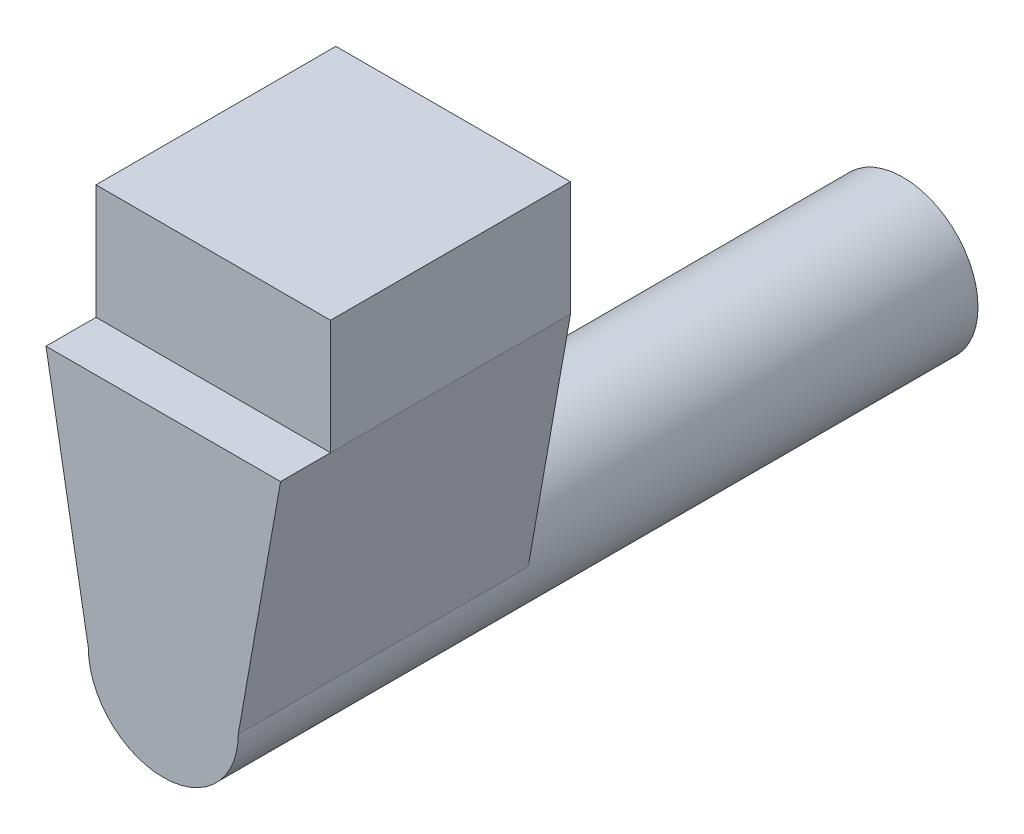
from build123d import *
from build123d.topology import SkipClean

# Parameters (mm, degrees)
SKETCH1_W               = 48
SKETCH1_H               = 53
BOSS_EXTRUDE1_DEPTH     = 10
SKETCH2_W               = 48
SKETCH2_H               = 5.616325
BOSS_EXTRUDE2_DEPTH     = 33.1917878
SKETCH4_W               = 4
SKETCH4_H               = 10
BOSS_EXTRUDE4_DEPTH     = 40
SKETCH5_W               = 48
SKETCH5_H               = 10.8609375
BOSS_EXTRUDE5_DEPTH     = 23.1917878
SKETCH6_W               = 48
SKETCH6_H               = 5
BOSS_EXTRUDE6_DEPTH     = 42.3
SKETCH7_W               = 12.8082122
SKETCH7_H               = 16.4772625
BOSS_EXTRUDE7_DEPTH     = 48
CUT_EXTRUDE1_REACH      = 84.426
SKETCH8_R               = 11.5
SKETCH8_R_2             = 2
FILLET1_R               = 10
FILLET2_R               = 4
SKETCH9_W               = 5
SKETCH9_H               = 16.4772625
BOSS_EXTRUDE9_DEPTH     = 48
CUT_EXTRUDE2_DEPTH      = 88.252507127
SKETCH11_W              = 51
SKETCH11_H              = 16.4772625
BOSS_EXTRUDE10_DEPTH    = 49.45
BOSS_EXTRUDE11_DEPTH    = 46
SKETCH16_W              = 47.95
SKETCH16_H              = 51
BOSS_EXTRUDE14_DEPTH    = 2.55
SKETCH14_W              = 5
SKETCH14_H              = 42.3
BOSS_EXTRUDE13_DEPTH    = 1.5
SKETCH17_W              = 51
SKETCH17_H              = 19.0272625
BOSS_EXTRUDE15_DEPTH    = 9
BOSS_EXTRUDE16_DEPTH    = 25
SKETCH19_R              = 1.9304
CUT_EXTRUDE3_DEPTH      = 125.404890183
MIRROR2_START           = 33.1917878
MIRROR2_DEPTH           = 51
MIRROR2_START_2         = 76.1917878
MIRROR2_2_OUTLINE_W     = 47.95
MIRROR2_2_OUTLINE_H     = 25
MIRROR2_2_OUTLINE_R     = 1.9304
MIRROR2_2_DEPTH         = 8
MIRROR2_3_OUTLINE_W     = 45
MIRROR2_3_OUTLINE_H     = 42.3
MIRROR2_3_OUTLINE_R     = 2
MIRROR2_3_OUTLINE_R_2   = 11.5
MIRROR2_3_DEPTH         = 5
SKETCH20_W              = 103.287975037
SKETCH20_H              = 97.84889924
CUT_EXTRUDE4_DEPTH      = 144.929961559
SKETCH21_W              = 49.5
SKETCH21_H              = 42.3
CUT_EXTRUDE5_DEPTH      = 128.391431036
SKETCH24_R              = 7.5
BOSS_EXTRUDE18_DEPTH    = 45
BOSS_EXTRUDE19_DEPTH    = 29
SKETCH26_R              = 3.937
CUT_EXTRUDE6_DEPTH      = 135.023808387
CUT_EXTRUDE7_DEPTH      = 133.174975247
CUT_EXTRUDE7_DEPTH_BACK = 133.174975247
SKETCH27_W              = 131.04651434
SKETCH27_H              = 69.942394415
SKETCH30_W              = 22
SKETCH30_H              = 11.4772625
SKETCH30_W_2            = 5
CUT_EXTRUDE10_DEPTH     = 95.954850856


# Read off the part's stored shape, not the designer's step: Mirror2
with BuildPart() as part:
    # Sketch1 → Boss-Extrude1 (new body)
    with BuildSketch(Plane.XY):
        with Locations((24, 26.5)):
            Rectangle(SKETCH1_W, SKETCH1_H)
    extrude(amount=BOSS_EXTRUDE1_DEPTH)

    # Sketch2 → Boss-Extrude2 (add)
    with BuildSketch(Plane(origin=(0, 0, 0), x_dir=(-1, 0, 0), z_dir=(0, 0, -1))):
        with Locations((-24, -2.8081625)):
            Rectangle(SKETCH2_W, SKETCH2_H)
    extrude(amount=-BOSS_EXTRUDE2_DEPTH)

    # Sketch4 → Boss-Extrude4 (add)
    with BuildSketch(Plane.XY.offset(10)):
        with Locations((2, 48)):
            Rectangle(SKETCH4_W, SKETCH4_H)
        with Locations((46, 48)):
            Rectangle(SKETCH4_W, SKETCH4_H)
    extrude(amount=BOSS_EXTRUDE4_DEPTH)

    # Sketch5 → Boss-Extrude5 (add)
    with BuildSketch(Plane.XY.offset(10)):
        with Locations((24, 5.43046875)):
            Rectangle(SKETCH5_W, SKETCH5_H)
    extrude(amount=BOSS_EXTRUDE5_DEPTH)

    # Sketch6 → Boss-Extrude6 (add)
    with BuildSketch(Plane.XZ.offset(5.616325)):
        with Locations((24, 30.6917878)):
            Rectangle(SKETCH6_W, SKETCH6_H)
    extrude(amount=BOSS_EXTRUDE6_DEPTH)

    # Sketch7 → Boss-Extrude7 (add)
    with BuildSketch(Plane.ZY):
        with Locations((-6.4041061, 2.62230625)):
            Rectangle(SKETCH7_W, SKETCH7_H)
    extrude(amount=-BOSS_EXTRUDE7_DEPTH)

    # Sketch8 → Cut-Extrude1 (cut, up to next)
    with BuildSketch(Plane(origin=(0, 0, 28.1917878), x_dir=(-1, 0, 0), z_dir=(0, 0, -1)), mode=Mode.PRIVATE) as cut_extrude1_sk1:
        with Locations((-24, -26.616325)):
            Circle(SKETCH8_R)
    cut_extrude1_tool1 = extrude(cut_extrude1_sk1.sketch, amount=-CUT_EXTRUDE1_REACH, mode=Mode.PRIVATE) & part.part
    # Sketch8 → Cut-Extrude1 (cut, up to next)
    with BuildSketch(Plane(origin=(0, 0, 28.1917878), x_dir=(-1, 0, 0), z_dir=(0, 0, -1)), mode=Mode.PRIVATE) as cut_extrude1_sk2:
        with Locations((-39.5, -11.116325)):
            Circle(SKETCH8_R_2)
    cut_extrude1_tool2 = extrude(cut_extrude1_sk2.sketch, amount=-CUT_EXTRUDE1_REACH, mode=Mode.PRIVATE) & part.part
    # Sketch8 → Cut-Extrude1 (cut, up to next)
    with BuildSketch(Plane(origin=(0, 0, 28.1917878), x_dir=(-1, 0, 0), z_dir=(0, 0, -1)), mode=Mode.PRIVATE) as cut_extrude1_sk3:
        with Locations((-39.5, -42.116325)):
            Circle(SKETCH8_R_2)
    cut_extrude1_tool3 = extrude(cut_extrude1_sk3.sketch, amount=-CUT_EXTRUDE1_REACH, mode=Mode.PRIVATE) & part.part
    # Sketch8 → Cut-Extrude1 (cut, up to next)
    with BuildSketch(Plane(origin=(0, 0, 28.1917878), x_dir=(-1, 0, 0), z_dir=(0, 0, -1)), mode=Mode.PRIVATE) as cut_extrude1_sk4:
        with Locations((-8.5, -11.116325)):
            Circle(SKETCH8_R_2)
    cut_extrude1_tool4 = extrude(cut_extrude1_sk4.sketch, amount=-CUT_EXTRUDE1_REACH, mode=Mode.PRIVATE) & part.part
    # Sketch8 → Cut-Extrude1 (cut, up to next)
    with BuildSketch(Plane(origin=(0, 0, 28.1917878), x_dir=(-1, 0, 0), z_dir=(0, 0, -1)), mode=Mode.PRIVATE) as cut_extrude1_sk5:
        with Locations((-8.5, -42.116325)):
            Circle(SKETCH8_R_2)
    cut_extrude1_tool5 = extrude(cut_extrude1_sk5.sketch, amount=-CUT_EXTRUDE1_REACH, mode=Mode.PRIVATE) & part.part
    add(cut_extrude1_tool1.solids().sort_by_distance((24, -26.616325, 28.191788))[0], mode=Mode.SUBTRACT)
    add(cut_extrude1_tool2.solids().sort_by_distance((39.5, -11.116325, 28.191788))[0], mode=Mode.SUBTRACT)
    add(cut_extrude1_tool3.solids().sort_by_distance((39.5, -42.116325, 28.191788))[0], mode=Mode.SUBTRACT)
    add(cut_extrude1_tool4.solids().sort_by_distance((8.5, -11.116325, 28.191788))[0], mode=Mode.SUBTRACT)
    add(cut_extrude1_tool5.solids().sort_by_distance((8.5, -42.116325, 28.191788))[0], mode=Mode.SUBTRACT)

    # Fillet1
    fillet1_edges = [part.edges().sort_by_distance(p)[0] for p in [
        (24, 10.8609375, 0),
    ]]
    fillet(fillet1_edges, radius=FILLET1_R)

    # Fillet2
    fillet2_edges = [part.edges().sort_by_distance(p)[0] for p in [
        (2, 43, 10),
        (46, 43, 10),
    ]]
    fillet(fillet2_edges, radius=FILLET2_R)

    # Sketch9 → Boss-Extrude9 (add)
    with BuildSketch(Plane(origin=(48, 0, 0), x_dir=(0, 0, -1), z_dir=(1, 0, 0))):
        with Locations((15.3082122, 2.62230625)):
            Rectangle(SKETCH9_W, SKETCH9_H)
    extrude(amount=-BOSS_EXTRUDE9_DEPTH)

    # Sketch10 → Cut-Extrude2 (cut, through all)
    with BuildSketch(Plane(origin=(48, 0, 0), x_dir=(0, 0, -1), z_dir=(1, 0, 0))):
        Polygon((17.8082122, 10.8609375), (-33.1917878, 10.8609375), (-76.887145623, 43.902095521), (-50.794096938, 74.436514195), (27.207463492, 71.105486703), align=None)
    extrude(amount=-CUT_EXTRUDE2_DEPTH, mode=Mode.SUBTRACT)

    # Sketch11 → Boss-Extrude10 (add)
    with BuildSketch(Plane(origin=(48, 0, 0), x_dir=(0, 0, -1), z_dir=(1, 0, 0))):
        with Locations((-7.6917878, 2.62230625)):
            Rectangle(SKETCH11_W, SKETCH11_H)
    extrude(amount=BOSS_EXTRUDE10_DEPTH)

    # Sketch12 → Boss-Extrude11 (add)
    with BuildSketch(Plane(origin=(0, 0, 28.1917878), x_dir=(-1, 0, 0), z_dir=(0, 0, -1))):
        Polygon((-48, -47.916325), (-45, -47.916325), (-45, -5.616325), (-49.5, -5.616325), (-49.5, -47.916325), align=None)
    extrude(amount=BOSS_EXTRUDE11_DEPTH)

    # Sketch16 → Boss-Extrude14 (add)
    with BuildSketch(Plane.XZ.offset(5.616325)):
        with Locations((73.475, 7.6917878)):
            Rectangle(SKETCH16_W, SKETCH16_H)
    extrude(amount=BOSS_EXTRUDE14_DEPTH)

    # Sketch14 → Boss-Extrude13 (add)
    with BuildSketch(Plane(origin=(49.5, 0, 0), x_dir=(0, 0, -1), z_dir=(1, 0, 0))):
        with Locations((-30.6917878, -26.766325)):
            Rectangle(SKETCH14_W, SKETCH14_H)
    extrude(amount=-BOSS_EXTRUDE13_DEPTH)

    # Sketch17 → Boss-Extrude15 (add)
    with BuildSketch(Plane(origin=(97.45, 0, 0), x_dir=(0, 0, -1), z_dir=(1, 0, 0))):
        with Locations((-7.6917878, 1.34730625)):
            Rectangle(SKETCH17_W, SKETCH17_H)
    extrude(amount=BOSS_EXTRUDE15_DEPTH)

    # Sketch18 → Boss-Extrude16 (add)
    with BuildSketch(Plane.XZ.offset(8.166325)):
        Polygon((49.5, -17.8082122), (106.45, -17.8082122), (106.45, -9.8082122), (106.45, 33.1917878), (97.45, 33.1917878), (97.45, -9.8082122), (49.5, -9.8082122), align=None)
    extrude(amount=BOSS_EXTRUDE16_DEPTH)

    # Sketch19 → Cut-Extrude3 (cut, through all)
    with BuildSketch(Plane.XY.offset(-9.8082122)):
        with Locations((58.475, -26.166325)):
            Circle(SKETCH19_R)
        with Locations((88.475, -26.166325)):
            Circle(SKETCH19_R)
    extrude(amount=-CUT_EXTRUDE3_DEPTH, mode=Mode.SUBTRACT)

    # Mirror2 outline → Mirror2 (add)
    with BuildSketch(Plane.XY.offset(MIRROR2_START)):
        Polygon((49.5, -47.916325), (49.5, -8.166325), (97.45, -8.166325), (97.45, -33.166325), (106.45, -33.166325), (106.45, 10.8609375), (0, 10.8609375), (0, -5.616325), (45, -5.616325), (45, -47.916325), align=None)
    extrude(amount=MIRROR2_DEPTH)

    # Mirror2 2 outline → Mirror2 2 (add)
    with BuildSketch(Plane.XY.offset(MIRROR2_START_2)):
        with Locations((73.475, -20.666325)):
            Rectangle(MIRROR2_2_OUTLINE_W, MIRROR2_2_OUTLINE_H)
        with Locations((58.475, -26.166325)):
            Circle(MIRROR2_2_OUTLINE_R, mode=Mode.SUBTRACT)
        with Locations((88.475, -26.166325)):
            Circle(MIRROR2_2_OUTLINE_R, mode=Mode.SUBTRACT)
    extrude(amount=MIRROR2_2_DEPTH)

    # Mirror2 3 outline → Mirror2 3 (add)
    with SkipClean():  # the faces are left unmerged after this step: merging them gives an invalid solid
        with BuildSketch(Plane.XY.offset(MIRROR2_START)):
            with Locations((22.5, -26.766325)):
                Rectangle(MIRROR2_3_OUTLINE_W, MIRROR2_3_OUTLINE_H)
            with Locations((8.5, -42.116325)):
                Circle(MIRROR2_3_OUTLINE_R, mode=Mode.SUBTRACT)
            with Locations((39.5, -42.116325)):
                Circle(MIRROR2_3_OUTLINE_R, mode=Mode.SUBTRACT)
            with Locations((24, -26.616325)):
                Circle(MIRROR2_3_OUTLINE_R_2, mode=Mode.SUBTRACT)
            with Locations((8.5, -11.116325)):
                Circle(MIRROR2_3_OUTLINE_R, mode=Mode.SUBTRACT)
            with Locations((39.5, -11.116325)):
                Circle(MIRROR2_3_OUTLINE_R, mode=Mode.SUBTRACT)
        extrude(amount=MIRROR2_3_DEPTH)

    # Sketch20 → Cut-Extrude4 (cut, through all)
    with BuildSketch(Plane.ZY):
        with Locations((-18.452199719, -38.06351212)):
            Rectangle(SKETCH20_W, SKETCH20_H)
    extrude(amount=-CUT_EXTRUDE4_DEPTH, mode=Mode.SUBTRACT)

    # Sketch21 → Cut-Extrude5 (cut, through all)
    with BuildSketch(Plane.XY.offset(84.1917878)):
        with Locations((24.75, -26.766325)):
            Rectangle(SKETCH21_W, SKETCH21_H)
    extrude(amount=-CUT_EXTRUDE5_DEPTH, mode=Mode.SUBTRACT)



with BuildPart() as body_2:
    # Sketch24 → Boss-Extrude18 (new body)
    with BuildSketch(Plane.XY.offset(55.1917878)):
        with Locations((24, -29.616325)):
            Circle(SKETCH24_R)
    extrude(amount=-BOSS_EXTRUDE18_DEPTH)


with BuildPart() as part_1:
    add(part.part)

    add(body_2.part)  # Boss-Extrude19 merges body 2
    # Sketch25 → Boss-Extrude19 (add)
    with BuildSketch(Plane.XY.offset(55.1917878)):
        with BuildLine():
            Line((16.5, -29.616325), (12.268152463, -5.616325))
            Line((12.268152463, -5.616325), (35.731847537, -5.616325))
            Line((35.731847537, -5.616325), (31.5, -29.616325))
            ThreePointArc((31.5, -29.616325), (24, -37.116325), (16.5, -29.616325))
        make_face()
    extrude(amount=BOSS_EXTRUDE19_DEPTH)

    # Sketch26 → Cut-Extrude6 (cut, through all)
    with BuildSketch(Plane.ZY.offset(-97.45)):
        with Locations((59.1917878, -16.166325)):
            Circle(SKETCH26_R)
    extrude(amount=-CUT_EXTRUDE6_DEPTH, mode=Mode.SUBTRACT)

    # Sketch27 → Cut-Extrude7 (cut, two sides: drawn at the far end of the back side and taken through both)
    with BuildSketch(Plane.XY.offset(79.1917878).offset(-CUT_EXTRUDE7_DEPTH_BACK)):
        with Locations((52.297526751, -17.773339354)):
            Rectangle(SKETCH27_W, SKETCH27_H)
        Polygon((12.268152463, -5.616325), (12.268152463, 5.8609375), (35.731847537, 5.8609375), (35.731847537, -5.616325), (35.731847537, -46.734959709), (12.268152463, -46.734959709), align=None, mode=Mode.SUBTRACT)
    extrude(amount=CUT_EXTRUDE7_DEPTH + CUT_EXTRUDE7_DEPTH_BACK, mode=Mode.SUBTRACT)

    # Sketch30 → Cut-Extrude10 (cut, through all)
    with BuildSketch(Plane.ZY.offset(-12.268152463)):
        with Locations((44.1917878, 0.12230625)):
            Rectangle(SKETCH30_W, SKETCH30_H)
        with Locations((81.6917878, 0.12230625)):
            Rectangle(SKETCH30_W_2, SKETCH30_H)
    extrude(amount=-CUT_EXTRUDE10_DEPTH, mode=Mode.SUBTRACT)


solid = part_1.part
